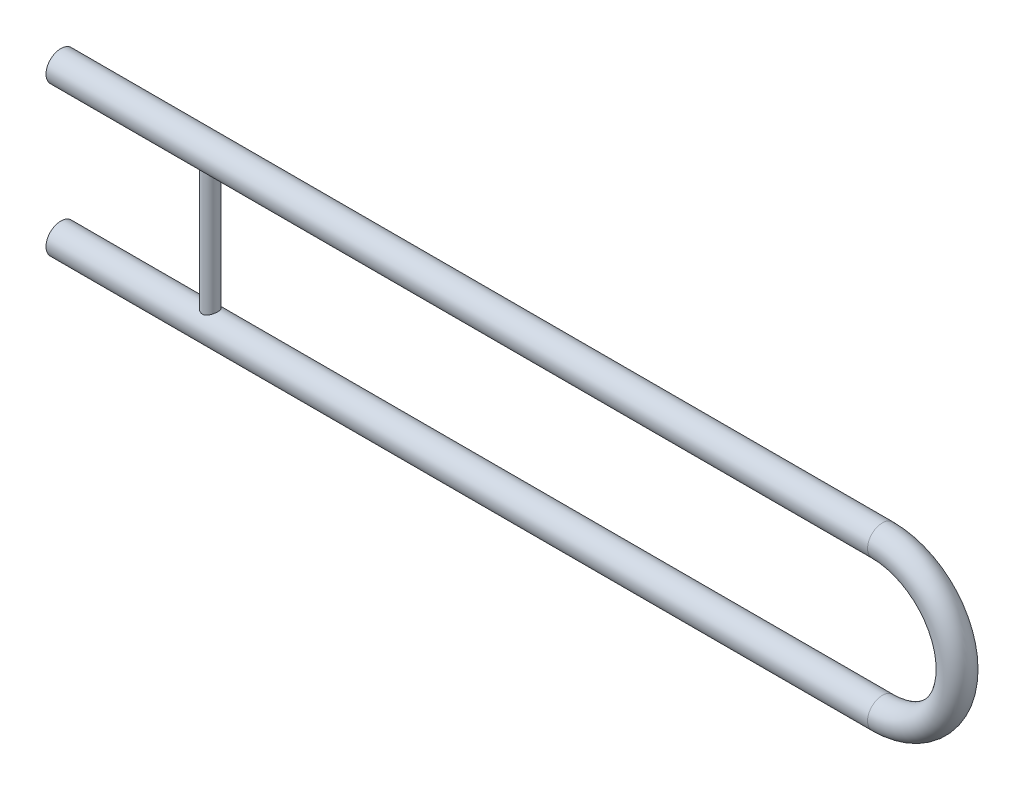
from build123d import *

# Parameters (mm, degrees)
SWEEP_THIN1_PROFILE_R   = 15.113
SWEEP_THIN1_PROFILE_R_2 = 13.589
SWEEP_THIN3_START       = 24.364184397
SWEEP_THIN3_OUTLINE_R   = 7.874
SWEEP_THIN3_OUTLINE_R_2 = 6.35
SWEEP_THIN3_DEPTH       = 152.4
CUT_EXTRUDE1_START      = -279.4
SKETCH47_R              = 13.589
CUT_EXTRUDE1_DEPTH      = 279.4
SKETCH48_R              = 13.589
CUT_EXTRUDE2_DEPTH      = 279.4


# Read off the part's stored shape, not the designer's step: Sweep-Thin3
with BuildPart() as part:
    # Sweep-Thin1: sweep along a path in Sketch1
    with BuildLine(Plane.XY) as sweep_thin1_path:
        Line((-567.536879433, 176.764184397), (270.663120567, 176.764184397))
        ThreePointArc((270.663120567, 176.764184397), (346.863120567, 100.564184397), (270.663120567, 24.364184397))
        Line((270.663120567, 24.364184397), (-567.536879433, 24.364184397))
    # Sweep-Thin1 profile (on start of the path) → Sweep-Thin1 (sweep)
    with BuildSketch(Plane(origin=(-567.536879433, 176.764184397, 0), x_dir=(0, 0, 1), z_dir=(1, 0, 0))):
        Circle(SWEEP_THIN1_PROFILE_R)
        Circle(SWEEP_THIN1_PROFILE_R_2, mode=Mode.SUBTRACT)
    sweep(path=sweep_thin1_path.line)

    # Sweep-Thin3 outline → Sweep-Thin3 (add)
    with BuildSketch(Plane(origin=(0, 0, 0), x_dir=(1, 0, 0), z_dir=(0, 1, 0)).offset(SWEEP_THIN3_START)):
        with Locations((-415.136879433, 0)):
            Circle(SWEEP_THIN3_OUTLINE_R)
        with Locations((-415.136879433, 0)):
            Circle(SWEEP_THIN3_OUTLINE_R_2, mode=Mode.SUBTRACT)
    extrude(amount=SWEEP_THIN3_DEPTH)

    # Sketch47 → Cut-Extrude1 (cut)
    with BuildSketch(Plane.ZY.offset(567.536879433).offset(CUT_EXTRUDE1_START)):
        with Locations(Location((0, 176.764184397, 0), (0, 0, 90))):
            Circle(SKETCH47_R)
    extrude(amount=CUT_EXTRUDE1_DEPTH, mode=Mode.SUBTRACT)

    # Sketch48 → Cut-Extrude2 (cut)
    with BuildSketch(Plane.ZY.offset(567.536879433)):
        with Locations(Location((0, 24.364184397, 0), (0, 0, 270))):
            Circle(SKETCH48_R)
    extrude(amount=-CUT_EXTRUDE2_DEPTH, mode=Mode.SUBTRACT)


solid = part.part
